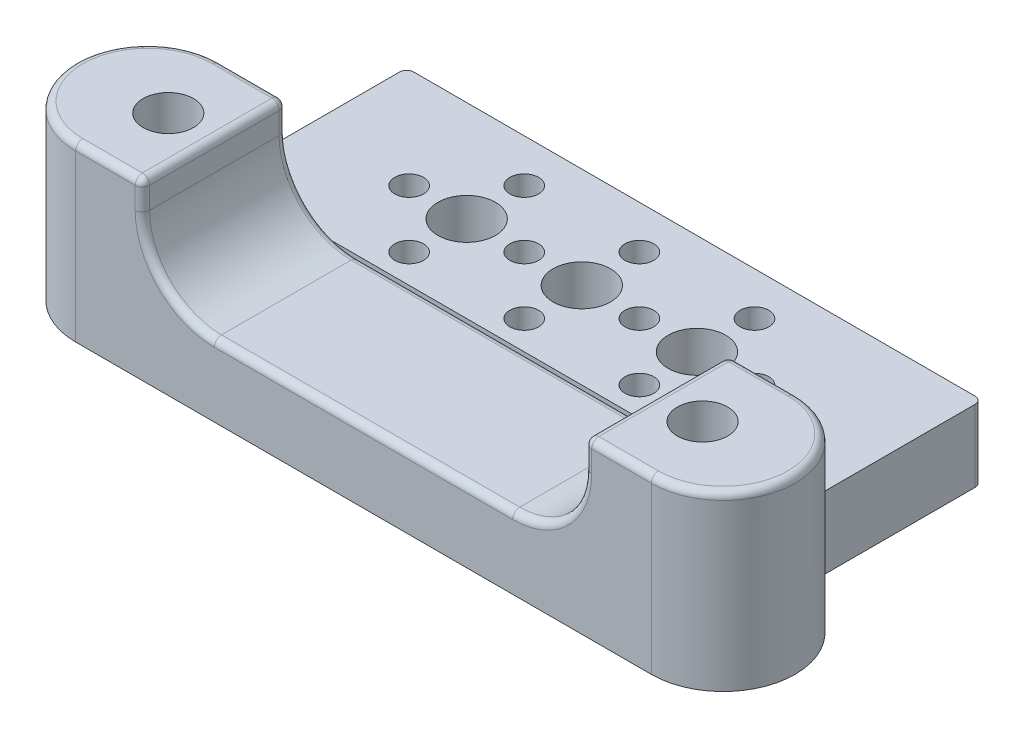
from build123d import *
from build123d.topology import SkipClean

# Parameters (mm, degrees)
SKETCH1_W           = 80
SKETCH1_H           = 20
BOSS_EXTRUDE1_DEPTH = 10
SKETCH2_R           = 3.5
CUT_EXTRUDE1_DEPTH  = 10
SKETCH3_R           = 3.5
BOSS_EXTRUDE2_DEPTH = 14
FILLET1_R           = 10
FILLET2_R           = 1
SKETCH4_W           = 80
SKETCH4_H           = 26
BOSS_EXTRUDE3_DEPTH = 10
FILLET6_R           = 1
SKETCH5_R           = 2
SKETCH5_R_2         = 4
CUT_EXTRUDE2_DEPTH  = 10


with BuildPart() as part:
    # Sketch1 → Boss-Extrude1 (new body)
    with BuildSketch(Plane(origin=(0, 0, 0), x_dir=(1, 0, 0), z_dir=(0, 1, 0))):
        Rectangle(SKETCH1_W, SKETCH1_H)
        with BuildLine():
            Line((-40, -10), (-40, 10))
            ThreePointArc((-40, 10), (-50, 0), (-40, -10))
        make_face()
        with BuildLine():
            ThreePointArc((40, 10), (50, 0), (40, -10))
            Line((40, -10), (40, 10))
        make_face()
    extrude(amount=BOSS_EXTRUDE1_DEPTH)

    # Sketch2 → Cut-Extrude1 (cut)
    with BuildSketch(Plane(origin=(0, 10, 0), x_dir=(1, 0, 0), z_dir=(0, 1, 0))):
        with Locations(Location((-37.125, 0, 0), (0, 0, 270))):
            Circle(SKETCH2_R)
        with Locations(Location((37.125, 0, 0), (0, 0, 270))):
            Circle(SKETCH2_R)
    extrude(amount=-CUT_EXTRUDE1_DEPTH, mode=Mode.SUBTRACT)

    # Sketch3 → Boss-Extrude2 (add)
    with SkipClean():  # the faces are left unmerged after this step: merging them gives an invalid solid
        with BuildSketch(Plane(origin=(0, 10, 0), x_dir=(1, 0, 0), z_dir=(0, 1, 0))):
            with BuildLine():
                Line((-30.726539984, 10), (-40, 10))
                ThreePointArc((-40, 10), (-50, 0), (-40, -10))
                Line((-40, -10), (-30.726539984, -10))
                Line((-30.726539984, -10), (-30.726539984, 10))
            make_face()
            with Locations((-37.125, 0)):
                Circle(SKETCH3_R, mode=Mode.SUBTRACT)
        boss_extrude2 = extrude(amount=BOSS_EXTRUDE2_DEPTH)
    add(part.part.scale(1), mode=Mode.REPLACE)  # the faces are merged on a copy

    # Mirror1: Boss-Extrude2 across plane
    with SkipClean():  # the faces are left unmerged after this step: merging them gives an invalid solid
        add(boss_extrude2.mirror(Plane(origin=(0, 0, 0), x_dir=(0, 0, 1), z_dir=(1, 0, 0))))

    # Fillet1
    fillet1_edges = [part.edges().sort_by_distance(p)[0] for p in [
        (30.726539984, 10, 0),
        (-30.726539984, 10, 0),
    ]]
    fillet(fillet1_edges, radius=FILLET1_R)

    # Fillet2
    fillet2_edges = [part.edges().sort_by_distance(p)[0] for p in [
        (-30.726539984, 22, -10),
        (-30.726539984, 24, 0),
        (-30.726539984, 22, 10),
        (-35.363269992, 24, -10),
        (-50, 24, 0),
        (-35.363269992, 24, 10),
        (35.363269992, 24, -10),
        (30.726539984, 22, -10),
        (35.363269992, 24, 10),
        (30.726539984, 22, 10),
        (50, 24, 0),
        (30.726539984, 24, 0),
        (0, 10, 10),
        (0, 10, -10),
        (27.797607796, 12.928932188, 10),
        (27.797607796, 12.928932188, -10),
        (-27.797607796, 12.928932188, 10),
        (-27.797607796, 12.928932188, -10),
    ]]
    fillet(fillet2_edges, radius=FILLET2_R)

    # Sketch4 → Boss-Extrude3 (add)
    with SkipClean():  # the faces are left unmerged after this step: merging them gives an invalid solid
        with BuildSketch(Plane(origin=(0, 0, 0), x_dir=(1, 0, 0), z_dir=(0, 1, 0))):
            with Locations((0, 23)):
                Rectangle(SKETCH4_W, SKETCH4_H)
        extrude(amount=BOSS_EXTRUDE3_DEPTH)

    # Fillet6
    # the kernel refuses this fillet: 1 mm, written as the material it adds along each edge
    with BuildSketch(Plane(origin=(-40, 10, -10), x_dir=(-0.9989642624898896, -1.4787641666586187e-15, 0.04550167324429737), z_dir=(0, -1, 0)), Plane(origin=(40, 0, -10), x_dir=(0.9989642624898897, 0, 0.04550167324429667), z_dir=(0, 1, 0))) as fillet6_piece_1:
        with BuildLine():
            CenterArc((0.955535138, 0.998964262), FILLET6_R, 182.607954285, 84.78409143)
            Line((-0.043429124, 0.953462589), (0, 0))
            ThreePointArc((0, 0), (0.455016732, 0.010357375), (0.910033465, 0))
        make_face()
    extrude(amount=10)
    # the kernel refuses this fillet: 1 mm, written as the material it takes off along each edge
    with BuildSketch(Plane(origin=(-40, -2.5, -36), x_dir=(0, 0, 1), z_dir=(0, 1, 0))) as fillet6_2_piece_1:
        with BuildLine():
            CenterArc((FILLET6_R, FILLET6_R), FILLET6_R, 180, 90)
            Line((0, FILLET6_R), (0, 0))
            Line((0, 0), (FILLET6_R, 0))
        make_face()
    extrude(amount=15, mode=Mode.SUBTRACT)
    with BuildSketch(Plane(origin=(40, -2.5, -36), x_dir=(0, 0, 1), z_dir=(0, 1, 0))) as fillet6_2_piece_2:
        with BuildLine():
            CenterArc((FILLET6_R, -FILLET6_R), FILLET6_R, 90, 90)
            Line((0, -FILLET6_R), (0, 0))
            Line((0, 0), (FILLET6_R, 0))
        make_face()
    extrude(amount=15, mode=Mode.SUBTRACT)

    # Sketch5 → Cut-Extrude2 (cut)
    with BuildSketch(Plane(origin=(0, 10, 0), x_dir=(1, 0, 0), z_dir=(0, 1, 0))):
        with Locations(Location((-9.65455784, 22, 0), (0, 0, 270))):
            Circle(SKETCH5_R)
        with Locations(Location((-17.65455784, 22, 0), (0, 0, 270))):
            Circle(SKETCH5_R_2)
        with Locations(Location((-17.65455784, 14, 0), (0, 0, 270))):
            Circle(SKETCH5_R)
        with Locations(Location((-25.65455784, 22, 0), (0, 0, 270))):
            Circle(SKETCH5_R)
        with Locations(Location((-17.65455784, 30, 0), (0, 0, 270))):
            Circle(SKETCH5_R)
        with Locations(Location((-1.65455784, 30, 0), (0, 0, 270))):
            Circle(SKETCH5_R)
        with Locations(Location((6.34544216, 22, 0), (0, 0, 270))):
            Circle(SKETCH5_R)
        with Locations(Location((-1.65455784, 14, 0), (0, 0, 270))):
            Circle(SKETCH5_R)
        with Locations(Location((-1.65455784, 22, 0), (0, 0, 270))):
            Circle(SKETCH5_R_2)
        with Locations(Location((22.34544216, 22, 0), (0, 0, 270))):
            Circle(SKETCH5_R)
        with Locations(Location((14.34544216, 14, 0), (0, 0, 270))):
            Circle(SKETCH5_R)
        with Locations(Location((14.34544216, 30, 0), (0, 0, 270))):
            Circle(SKETCH5_R)
        with Locations(Location((14.34544216, 22, 0), (0, 0, 270))):
            Circle(SKETCH5_R_2)
    extrude(amount=-CUT_EXTRUDE2_DEPTH, mode=Mode.SUBTRACT)


solid = part.part
